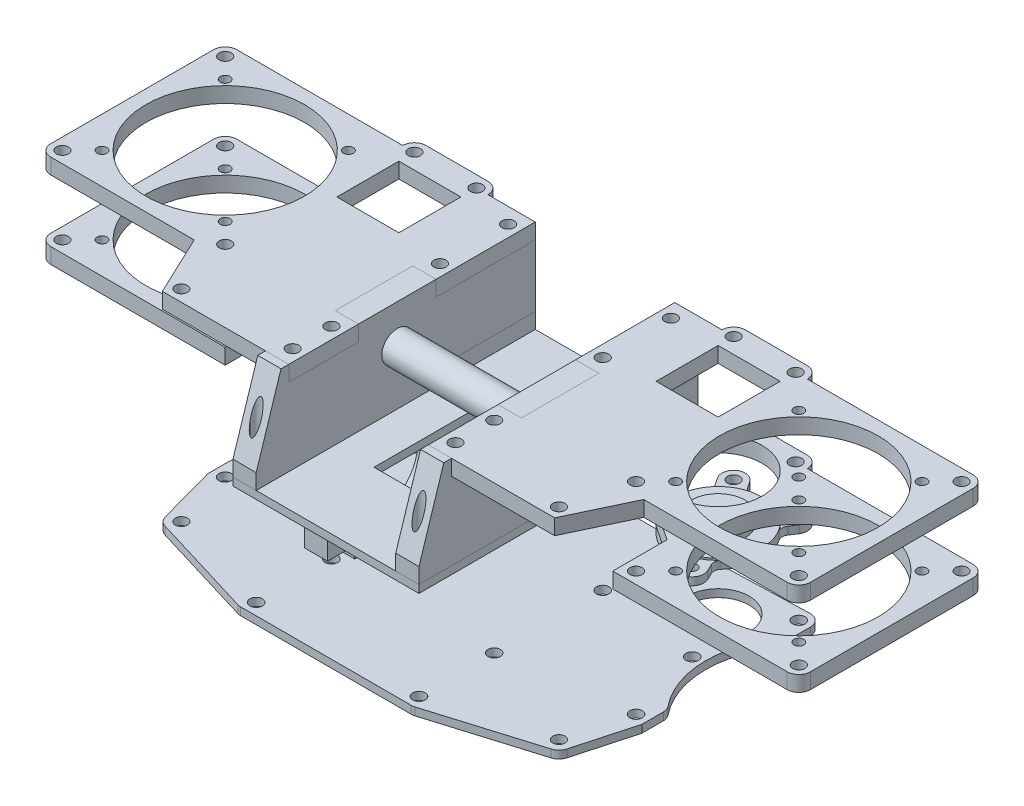
from build123d import *
from build123d.topology import SkipClean

# Parameters (mm, degrees)
BOSS_EXTRUDE1_DEPTH      = 9.525
SKETCH7_R                = 32.5
SKETCH7_R_2              = 3.175
BOSS_EXTRUDE2_DEPTH      = 6.35
SKETCH8_R                = 32.5
SKETCH8_R_2              = 18
BOSS_EXTRUDE3_DEPTH      = 6.35
BOSS_EXTRUDE4_DEPTH      = 6.35
BOSS_EXTRUDE5_START      = 31.75
BOSS_EXTRUDE5_DEPTH      = 6.35
SKETCH15_R               = 2.4892
CUT_EXTRUDE9_DEPTH       = 178.374267088
SKETCH16_R               = 6.35
CUT_EXTRUDE10_DEPTH      = 9.525
SKETCH19_R               = 2.0193
CUT_EXTRUDE11_DEPTH      = 178.374267088
SKETCH22_R               = 2.0193
CUT_EXTRUDE12_DEPTH      = 6.35
SKETCH41_R               = 2.0193
CUT_EXTRUDE23_DEPTH      = 178.374267088
CHAMFER1_SIZE            = 12.7
CHAMFER1_SIZE2           = 19.05
SKETCH42_W               = 25.4
SKETCH42_H               = 25.4
CUT_EXTRUDE24_DEPTH      = 6.35
SKETCH17_R               = 6.35
BOSS_EXTRUDE6_DEPTH      = 76.2
SKETCH24_W               = 76.2
SKETCH24_H               = 114.3
SKETCH24_R               = 2.5527
BOSS_EXTRUDE8_DEPTH      = 3.175
SKETCH25_W               = 25.4
SKETCH25_H               = 50.8
CUT_EXTRUDE13_DEPTH      = 178.374267088
SKETCH34_R               = 2.0193
CUT_EXTRUDE20_DEPTH      = 6.35
SKETCH21_R               = 2.5527
SKETCH21_R_2             = 2.4892
BOSS_EXTRUDE7_DEPTH      = 3.175
SKETCH26_W               = 57.15
SKETCH26_H               = 41.275
SKETCH26_R               = 18
BOSS_EXTRUDE9_DEPTH      = 9.525
SKETCH27_R               = 2.5527
CUT_EXTRUDE14_DEPTH      = 192.897168101
SKETCH28_W               = 11.1125
SKETCH28_H               = 4.7625
CUT_EXTRUDE15_DEPTH      = 228.583503906
SKETCH30_R               = 2.5527
CUT_EXTRUDE16_DEPTH      = 194.284236941
CUT_EXTRUDE17_REACH      = 193.897
CUT_EXTRUDE17_END_RADIUS = 18
SKETCH31_R               = 2.0193
SKETCH32_W               = 57.15
SKETCH32_H               = 0.254
CUT_EXTRUDE18_DEPTH      = 228.583503906
CUT_EXTRUDE19_DEPTH      = 3.175
FILLET1_R                = 4.7625
SKETCH35_R               = 2.0193
SKETCH35_R_2             = 2.4892
BOSS_EXTRUDE10_DEPTH     = 3.175
SKETCH36_R               = 18
BOSS_EXTRUDE11_DEPTH     = 0.762
SKETCH37_R               = 10.9982
BOSS_EXTRUDE12_DEPTH     = 2.413
SKETCH38_R               = 3.9878
CUT_EXTRUDE21_DEPTH      = 182.44784719
FILLET2_R                = 3.175
SKETCH39_R               = 12.7
CUT_EXTRUDE22_DEPTH      = 3.175


with BuildPart() as part:
    # Sketch6 → Boss-Extrude1 (new body)
    with BuildSketch(Plane(origin=(28.575, 0, 0), x_dir=(0, 0, -1), z_dir=(1, 0, 0))):
        Polygon((-76.2, 60.325), (-66.04, 92.075), (-62.865, 92.075), (-62.865, 85.725), (-34.29, 85.725), (-34.29, 92.075), (-2.54, 92.075), (-2.54, 85.725), (38.1, 85.725), (38.1, 60.325), (-2.54, 60.325), (-2.54, 53.975), (-76.2, 53.975), align=None)
    extrude(amount=BOSS_EXTRUDE1_DEPTH)

    # Sketch16 → Cut-Extrude10 (cut)
    with BuildSketch(Plane.ZY.offset(-28.575)):
        with Locations((18.415, 76.2)):
            Circle(SKETCH16_R)
    extrude(amount=-CUT_EXTRUDE10_DEPTH, mode=Mode.SUBTRACT)

    # Sketch19 → Cut-Extrude11 (cut, through all)
    with BuildSketch(Plane.XZ.offset(-53.975)):
        with Locations(Location((33.3375, -3.81, 0), (0, 0, 270))):
            Circle(SKETCH19_R)
        with Locations(Location((33.3375, -31.75, 0), (0, 0, 270))):
            Circle(SKETCH19_R)
        with Locations(Location((33.3375, 40.64, 0), (0, 0, 270))):
            Circle(SKETCH19_R)
        with Locations(Location((33.3375, 71.4375, 0), (0, 0, 270))):
            Circle(SKETCH19_R)
        with Locations(Location((33.3375, 56.515, 0), (0, 0, 270))):
            Circle(SKETCH19_R)
    extrude(amount=-CUT_EXTRUDE11_DEPTH, mode=Mode.SUBTRACT)


with BuildPart() as body_2:
    # Sketch7 → Boss-Extrude2 (new body)
    with BuildSketch(Plane(origin=(0, 85.725, 0), x_dir=(1, 0, 0), z_dir=(0, 1, 0))):
        Polygon((28.575, -62.865), (80.340904861, -62.865), (92.075, -38.1), (117.475, -38.1), (155.575, -38.1), (155.575, 38.1), (28.575, 38.1), (28.575, -2.54), (38.1, -2.54), (38.1, -34.29), (28.575, -34.29), align=None)
        with Locations(Location((117.475, 0, 0), (0, 0, 90))):
            Circle(SKETCH7_R, mode=Mode.SUBTRACT)
        with Locations(Location((65.388447716, 19.05, 0), (0, 0, 90))):
            Circle(SKETCH7_R_2, mode=Mode.SUBTRACT)
    extrude(amount=BOSS_EXTRUDE2_DEPTH)

    # Sketch14<2> → Boss-Extrude5 (add)
    with BuildSketch(Plane(origin=(0, 60.325, 0), x_dir=(1, 0, 0), z_dir=(0, 1, 0)).offset(BOSS_EXTRUDE5_START)):
        with BuildLine():
            Line((78.088447716, 42.8625), (52.688447716, 42.8625))
            ThreePointArc((52.688447716, 42.8625), (49.320851671, 34.732403955), (57.450947716, 38.1))
            Line((57.450947716, 38.1), (73.325947716, 38.1))
            ThreePointArc((73.325947716, 38.1), (81.456043762, 34.732403955), (78.088447716, 42.8625))
        make_face()
    extrude(amount=-BOSS_EXTRUDE5_DEPTH)


with BuildPart() as body_3:
    # Sketch8 → Boss-Extrude3 (new body)
    with BuildSketch(Plane(origin=(0, 60.325, 0), x_dir=(-1, 0, 0), z_dir=(0, -1, 0))):
        Polygon((-79.375, -38.1), (-155.575, -38.1), (-155.575, 38.1), (-79.375, 38.1), (-28.575, 38.1), (-28.575, -2.54), (-38.1, -2.54), (-38.1, -3.175), (-79.375, -3.175), align=None)
        with Locations(Location((-117.475, 0, 0), (0, 0, 90))):
            Circle(SKETCH8_R, mode=Mode.SUBTRACT)
        with Locations(Location((-65.388447716, 19.05, 0), (0, 0, 90))):
            Circle(SKETCH8_R_2, mode=Mode.SUBTRACT)
    extrude(amount=BOSS_EXTRUDE3_DEPTH)

    # Sketch14 → Boss-Extrude4 (add)
    with BuildSketch(Plane(origin=(0, 60.325, 0), x_dir=(1, 0, 0), z_dir=(0, 1, 0))):
        with BuildLine():
            Line((78.088447716, 42.8625), (52.688447716, 42.8625))
            ThreePointArc((52.688447716, 42.8625), (49.320851671, 34.732403955), (57.450947716, 38.1))
            Line((57.450947716, 38.1), (73.325947716, 38.1))
            ThreePointArc((73.325947716, 38.1), (81.456043762, 34.732403955), (78.088447716, 42.8625))
        make_face()
    extrude(amount=-BOSS_EXTRUDE4_DEPTH)


with BuildPart() as cut_extrude9_tool:
    # Sketch15 → Cut-Extrude9 (new, through all)
    with BuildSketch(Plane.XZ.offset(-53.975)):
        with Locations(Location((52.688447716, -38.1, 0), (0, 0, 270))):
            Circle(SKETCH15_R)
        with Locations(Location((78.088447716, -38.1, 0), (0, 0, 270))):
            Circle(SKETCH15_R)
        with Locations(Location((150.8125, -33.3375, 0), (0, 0, 270))):
            Circle(SKETCH15_R)
        with Locations(Location((150.8125, 33.3375, 0), (0, 0, 270))):
            Circle(SKETCH15_R)
        with Locations(Location((84.1375, 33.3375, 0), (0, 0, 270))):
            Circle(SKETCH15_R)
        with Locations(Location((33.3375, -31.75, 0), (0, 0, 270))):
            Circle(SKETCH15_R)
        with Locations(Location((33.3375, -3.81, 0), (0, 0, 270))):
            Circle(SKETCH15_R)
        with Locations(Location((33.3375, 40.64, 0), (0, 0, 270))):
            Circle(SKETCH15_R)
        with Locations(Location((77.327408996, 58.1025, 0), (0, 0, 270))):
            Circle(SKETCH15_R)
        with Locations(Location((33.3375, 56.515, 0), (0, 0, 270))):
            Circle(SKETCH15_R)
        with BuildLine():
            Line((150.8125, 38.1), (155.575, 38.1))
            Line((155.575, 38.1), (155.575, 33.3375))
            ThreePointArc((155.575, 33.3375), (154.180096045, 36.705096045), (150.8125, 38.1))
        make_face()
        with BuildLine():
            Line((150.8125, -38.1), (155.575, -38.1))
            Line((155.575, -38.1), (155.575, -33.3375))
            ThreePointArc((155.575, -33.3375), (154.180096045, -36.705096045), (150.8125, -38.1))
        make_face()
    extrude(amount=-CUT_EXTRUDE9_DEPTH)


with BuildPart() as body_3_1:
    add(body_3.part)

    # Cut-Extrude9: cut by cut_extrude9_tool
    add(cut_extrude9_tool.part, mode=Mode.SUBTRACT)

    # Sketch22 → Cut-Extrude12 (cut)
    with BuildSketch(Plane.XZ.offset(-53.975)):
        with Locations(Location((84.1375, -33.3375, 0), (0, 0, 270))):
            Circle(SKETCH22_R)
    extrude(amount=-CUT_EXTRUDE12_DEPTH, mode=Mode.SUBTRACT)


with BuildPart() as body_2_1:
    add(body_2.part)

    # Cut-Extrude9: cut by cut_extrude9_tool
    add(cut_extrude9_tool.part, mode=Mode.SUBTRACT)


with BuildPart() as cut_extrude23_tool:
    # Sketch41 → Cut-Extrude23 (new, through all)
    with BuildSketch(Plane(origin=(0, 92.075, 0), x_dir=(1, 0, 0), z_dir=(0, 1, 0))):
        with Locations(Location((92.248965581, 25.226034419, 0), (0, 0, 270))):
            Circle(SKETCH41_R)
        with Locations(Location((142.701034419, 25.226034419, 0), (0, 0, 270))):
            Circle(SKETCH41_R)
        with Locations(Location((142.701034419, -25.226034419, 0), (0, 0, 270))):
            Circle(SKETCH41_R)
        with Locations(Location((92.248965581, -25.226034419, 0), (0, 0, 270))):
            Circle(SKETCH41_R)
    extrude(amount=-CUT_EXTRUDE23_DEPTH)


with BuildPart() as body_2_2:
    add(body_2_1.part)

    # Cut-Extrude23: cut by cut_extrude23_tool
    add(cut_extrude23_tool.part, mode=Mode.SUBTRACT)

    # Sketch42 → Cut-Extrude24 (cut)
    with BuildSketch(Plane(origin=(0, 92.075, 0), x_dir=(1, 0, 0), z_dir=(0, 1, 0))):
        with Locations((65.388447716, 19.05)):
            Rectangle(SKETCH42_W, SKETCH42_H)
    extrude(amount=-CUT_EXTRUDE24_DEPTH, mode=Mode.SUBTRACT)


with BuildPart() as body_3_2:
    add(body_3_1.part)

    # Cut-Extrude23: cut by cut_extrude23_tool
    add(cut_extrude23_tool.part, mode=Mode.SUBTRACT)

    # Chamfer1
    chamfer1_edges = [body_3_2.edges().sort_by_distance(p)[0] for p in [
        (79.375, 57.15, 3.175),
    ]]
    chamfer1_side = [body_3_2.faces().sort_by_distance(p)[0] for p in [
        (79.375, 57.15, 20.6375),
    ]]
    chamfer(chamfer1_edges, length=CHAMFER1_SIZE, length2=CHAMFER1_SIZE2, reference=chamfer1_side[0])


with BuildPart() as body_4:
    # Mirror2: mirrored copy
    add(part.part.mirror(Plane(origin=(0, 0, 0), x_dir=(0, 0, 1), z_dir=(1, 0, 0))))


with BuildPart() as body_5:
    # Mirror2 2: mirrored copy
    add(body_2_2.part.mirror(Plane(origin=(0, 0, 0), x_dir=(0, 0, 1), z_dir=(1, 0, 0))))


with BuildPart() as body_6:
    # Mirror2 3: mirrored copy
    add(body_3_2.part.mirror(Plane(origin=(0, 0, 0), x_dir=(0, 0, 1), z_dir=(1, 0, 0))))


with BuildPart() as body_7:
    # Sketch17 → Boss-Extrude6 (new body)
    with BuildSketch(Plane(origin=(38.1, 0, 0), x_dir=(0, 0, -1), z_dir=(1, 0, 0))):
        with Locations((-18.415, 76.2)):
            Circle(SKETCH17_R)
    extrude(amount=-BOSS_EXTRUDE6_DEPTH)


with BuildPart() as body_8:
    # Sketch24 → Boss-Extrude8 (new body)
    with BuildSketch(Plane.XZ.offset(-53.975)):
        with Locations((0, 19.05)):
            Rectangle(SKETCH24_W, SKETCH24_H)
        with Locations(Location((-33.3375, 71.4375, 0), (0, 0, 270))):
            Circle(SKETCH24_R, mode=Mode.SUBTRACT)
        with Locations(Location((33.3375, 71.4375, 0), (0, 0, 270))):
            Circle(SKETCH24_R, mode=Mode.SUBTRACT)
        with Locations(Location((33.3375, 40.64, 0), (0, 0, 270))):
            Circle(SKETCH24_R, mode=Mode.SUBTRACT)
        with Locations(Location((-33.3375, 40.64, 0), (0, 0, 270))):
            Circle(SKETCH24_R, mode=Mode.SUBTRACT)
        with Locations(Location((-33.3375, -3.81, 0), (0, 0, 270))):
            Circle(SKETCH24_R, mode=Mode.SUBTRACT)
        with Locations(Location((33.3375, -3.81, 0), (0, 0, 270))):
            Circle(SKETCH24_R, mode=Mode.SUBTRACT)
        with Locations(Location((33.3375, -31.75, 0), (0, 0, 270))):
            Circle(SKETCH24_R, mode=Mode.SUBTRACT)
        with Locations(Location((-33.3375, -31.75, 0), (0, 0, 270))):
            Circle(SKETCH24_R, mode=Mode.SUBTRACT)
        with Locations(Location((33.3375, 56.515, 0), (0, 0, 270))):
            Circle(SKETCH24_R, mode=Mode.SUBTRACT)
        with Locations(Location((-33.3375, 56.515, 0), (0, 0, 270))):
            Circle(SKETCH24_R, mode=Mode.SUBTRACT)
    extrude(amount=BOSS_EXTRUDE8_DEPTH)

    # Sketch25 → Cut-Extrude13 (cut, through all)
    with BuildSketch(Plane(origin=(0, 53.975, 0), x_dir=(1, 0, 0), z_dir=(0, 1, 0))):
        with Locations((0, -18.415)):
            Rectangle(SKETCH25_W, SKETCH25_H)
    extrude(amount=-CUT_EXTRUDE13_DEPTH, mode=Mode.SUBTRACT)


with BuildPart() as cut_extrude20_tool:
    # Sketch34 → Cut-Extrude20 (new body)
    with BuildSketch(Plane.XZ.offset(-53.975)):
        with Locations(Location((75.276593569, 1.452584663, 0), (0, 0, 270))):
            Circle(SKETCH34_R)
        with Locations(Location((-75.276593569, 1.452584663, 0), (0, 0, 270))):
            Circle(SKETCH34_R)
        with Locations(Location((42.8625, -15.776914951, 0), (0, 0, 270))):
            Circle(SKETCH34_R)
        with Locations(Location((-42.8625, -15.776914951, 0), (0, 0, 270))):
            Circle(SKETCH34_R)
    extrude(amount=-CUT_EXTRUDE20_DEPTH)


with BuildPart() as body_3_3:
    add(body_3_2.part)

    # Cut-Extrude20: cut by cut_extrude20_tool
    add(cut_extrude20_tool.part, mode=Mode.SUBTRACT)


with BuildPart() as body_6_1:
    add(body_6.part)

    # Cut-Extrude20: cut by cut_extrude20_tool
    add(cut_extrude20_tool.part, mode=Mode.SUBTRACT)


with BuildPart() as body_9:
    # Sketch21 → Boss-Extrude7 (new body)
    with BuildSketch(Plane(origin=(0, 9.525, 0), x_dir=(-1, 0, 0), z_dir=(0, -1, 0))):
        Polygon((-88.9, -35.71875), (-88.9, 38.251152997), (-33.263104096, 36.5125), (33.263104096, 36.5125), (88.9, 38.251152997), (88.9, -35.71875), (81.599955368, -62.265473852), (35.632311037, -76.2), (34.925, -76.2), (-34.925, -76.2), (-35.632311037, -76.2), (-81.599955368, -62.265473852), align=None)
        with Locations(Location((-84.1375, 33.3375, 0), (0, 0, 90))):
            Circle(SKETCH21_R, mode=Mode.SUBTRACT)
        with Locations(Location((-84.1375, -33.3375, 0), (0, 0, 90))):
            Circle(SKETCH21_R, mode=Mode.SUBTRACT)
        with Locations(Location((-33.3375, 31.75, 0), (0, 0, 90))):
            Circle(SKETCH21_R, mode=Mode.SUBTRACT)
        with Locations(Location((-33.3375, 3.81, 0), (0, 0, 90))):
            Circle(SKETCH21_R, mode=Mode.SUBTRACT)
        with Locations(Location((-33.3375, -40.64, 0), (0, 0, 90))):
            Circle(SKETCH21_R, mode=Mode.SUBTRACT)
        with Locations(Location((-33.3375, -71.4375, 0), (0, 0, 90))):
            Circle(SKETCH21_R, mode=Mode.SUBTRACT)
        with Locations(Location((33.3375, -71.4375, 0), (0, 0, 90))):
            Circle(SKETCH21_R, mode=Mode.SUBTRACT)
        with Locations(Location((33.3375, -40.64, 0), (0, 0, 90))):
            Circle(SKETCH21_R, mode=Mode.SUBTRACT)
        with Locations(Location((33.3375, 3.81, 0), (0, 0, 90))):
            Circle(SKETCH21_R, mode=Mode.SUBTRACT)
        with Locations(Location((33.3375, 31.75, 0), (0, 0, 90))):
            Circle(SKETCH21_R, mode=Mode.SUBTRACT)
        with Locations(Location((84.1375, 33.3375, 0), (0, 0, 90))):
            Circle(SKETCH21_R, mode=Mode.SUBTRACT)
        with Locations(Location((84.1375, -33.3375, 0), (0, 0, 90))):
            Circle(SKETCH21_R, mode=Mode.SUBTRACT)
        with Locations(Location((-77.327408996, -58.1025, 0), (0, 0, 90))):
            Circle(SKETCH21_R_2, mode=Mode.SUBTRACT)
        with Locations(Location((-75.276593569, -1.452584663, 0), (0, 0, 90))):
            Circle(SKETCH21_R, mode=Mode.SUBTRACT)
        with Locations(Location((75.276593569, -1.452584663, 0), (0, 0, 90))):
            Circle(SKETCH21_R, mode=Mode.SUBTRACT)
        with Locations(Location((-42.8625, 15.776914951, 0), (0, 0, 90))):
            Circle(SKETCH21_R, mode=Mode.SUBTRACT)
        with Locations(Location((42.8625, 15.776914951, 0), (0, 0, 90))):
            Circle(SKETCH21_R, mode=Mode.SUBTRACT)
        with Locations(Location((77.327408996, -58.1025, 0), (0, 0, 90))):
            Circle(SKETCH21_R_2, mode=Mode.SUBTRACT)
    extrude(amount=BOSS_EXTRUDE7_DEPTH)

    # Sketch30 → Cut-Extrude16 (cut, through all)
    with BuildSketch(Plane.XZ.offset(-6.35)):
        with Locations(Location((-33.3375, 31.115, 0), (0, 0, 270))):
            Circle(SKETCH30_R)
        with Locations(Location((-33.3375, 5.715, 0), (0, 0, 270))):
            Circle(SKETCH30_R)
    extrude(amount=-CUT_EXTRUDE16_DEPTH, mode=Mode.SUBTRACT)

    # Sketch33 → Cut-Extrude19 (cut)
    with BuildSketch(Plane.XZ.offset(-6.35)):
        with BuildLine():
            Line((88.9, -25.200781238), (88.9, 25.200781238))
            ThreePointArc((88.9, 25.200781238), (79.375, 0), (88.9, -25.200781238))
        make_face()
        with BuildLine():
            Line((-88.9, -25.200781238), (-88.9, 25.200781238))
            ThreePointArc((-88.9, 25.200781238), (-79.375, 0), (-88.9, -25.200781238))
        make_face()
    extrude(amount=-CUT_EXTRUDE19_DEPTH, mode=Mode.SUBTRACT)

    # Fillet1
    fillet1_edges = [body_9.edges().sort_by_distance(p)[0] for p in [
        (88.9, 7.9375, -25.200781238),
        (88.9, 7.9375, 25.200781238),
        (-88.9, 7.9375, 25.200781238),
        (-88.9, 7.9375, -25.200781238),
        (88.9, 7.9375, -38.251152997),
        (-88.9, 7.9375, -38.251152997),
        (-81.599955368, 7.9375, 62.265473852),
        (-35.632311037, 7.9375, 76.2),
        (35.632311037, 7.9375, 76.2),
        (81.599955368, 7.9375, 62.265473852),
    ]]
    fillet(fillet1_edges, radius=FILLET1_R)

    # Sketch39 → Cut-Extrude22 (cut)
    with BuildSketch(Plane.XZ.offset(-6.35)):
        with Locations(Location((-65.388447716, -19.05, 0), (0, 0, 270))):
            Circle(SKETCH39_R)
        with Locations(Location((65.388447716, -19.05, 0), (0, 0, 270))):
            Circle(SKETCH39_R)
    extrude(amount=-CUT_EXTRUDE22_DEPTH, mode=Mode.SUBTRACT)


with BuildPart() as body_10:
    # Sketch26 → Boss-Extrude9 (new body)
    with BuildSketch(Plane.ZY.offset(38.1)):
        with Locations((18.415, 30.1625)):
            Rectangle(SKETCH26_W, SKETCH26_H)
        with Locations((18.415, 28.575)):
            Circle(SKETCH26_R, mode=Mode.SUBTRACT)
    extrude(amount=-BOSS_EXTRUDE9_DEPTH)

    # Sketch27 → Cut-Extrude14 (cut, through all)
    with BuildSketch(Plane.XZ.offset(-9.525)):
        with Locations(Location((-33.3375, -3.81, 0), (0, 0, 270))):
            Circle(SKETCH27_R)
        with Locations(Location((-33.3375, 40.64, 0), (0, 0, 270))):
            Circle(SKETCH27_R)
    extrude(amount=-CUT_EXTRUDE14_DEPTH, mode=Mode.SUBTRACT)

    # Sketch28 → Cut-Extrude15 (cut, through all)
    with BuildSketch(Plane.ZY.offset(38.1)):
        with Locations((-4.60375, 11.90625)):
            Rectangle(SKETCH28_W, SKETCH28_H)
        with Locations((41.43375, 11.90625)):
            Rectangle(SKETCH28_W, SKETCH28_H)
    extrude(amount=-CUT_EXTRUDE15_DEPTH, mode=Mode.SUBTRACT)

    # Cut-Extrude17: up to this cylinder (the profile starts outside it)
    cut_extrude17_end = Plane(origin=(-33.3375, 28.575, 18.415), z_dir=(-1, 0, 0)) * Cylinder(CUT_EXTRUDE17_END_RADIUS, 424.794, mode=Mode.PRIVATE)
    # Sketch31 → Cut-Extrude17 (cut, up to the surface)
    with BuildSketch(Plane.XZ.offset(-9.525), mode=Mode.PRIVATE) as cut_extrude17_sk1:
        with Locations(Location((-33.3375, 5.715, 0), (0, 0, 270))):
            Circle(SKETCH31_R)
    cut_extrude17_tool1 = extrude(cut_extrude17_sk1.sketch, amount=-CUT_EXTRUDE17_REACH, mode=Mode.PRIVATE) - cut_extrude17_end
    add(cut_extrude17_tool1.solids().sort_by_distance((-33.3375, 9.525, 5.715))[0], mode=Mode.SUBTRACT)
    # Sketch31 → Cut-Extrude17 (cut, up to the surface)
    with BuildSketch(Plane.XZ.offset(-9.525), mode=Mode.PRIVATE) as cut_extrude17_sk2:
        with Locations(Location((-33.3375, 31.115, 0), (0, 0, 270))):
            Circle(SKETCH31_R)
    cut_extrude17_tool2 = extrude(cut_extrude17_sk2.sketch, amount=-CUT_EXTRUDE17_REACH, mode=Mode.PRIVATE) - cut_extrude17_end
    add(cut_extrude17_tool2.solids().sort_by_distance((-33.3375, 9.525, 31.115))[0], mode=Mode.SUBTRACT)

    # Sketch32 → Cut-Extrude18 (cut, through all)
    with BuildSketch(Plane.ZY.offset(38.1)):
        with Locations((18.415, 28.575)):
            Rectangle(SKETCH32_W, SKETCH32_H)
    extrude(amount=-CUT_EXTRUDE18_DEPTH, mode=Mode.SUBTRACT)


with BuildPart() as cut_extrude18_piece_1:
    # of the separate pieces the step leaves, piece 1, a body of its own (cut_extrude18_pieces)
    add(body_10.part.solids().sort_by_distance((-38.1, 50.8, -10.16))[0])


with BuildPart() as cut_extrude18_piece_2:
    # of the separate pieces the step leaves, piece 2, a body of its own (cut_extrude18_pieces)
    add(body_10.part.solids().sort_by_distance((-38.1, 9.525, 0.9525))[0])


with BuildPart() as body_12:
    # Sketch35 → Boss-Extrude10 (new body)
    with BuildSketch(Plane(origin=(0, 41.275, 0), x_dir=(-1, 0, 0), z_dir=(0, -1, 0))):
        with BuildLine():
            Line((-79.5662612, 0.616269577), (-77.218749503, 5.483719757))
            ThreePointArc((-77.218749503, 5.483719757), (-83.345227072, 17.803374484), (-78.979867719, 30.85141103))
            Line((-78.979867719, 30.85141103), (-82.051087243, 35.458240315))
            ThreePointArc((-82.051087243, 35.458240315), (-80.730207401, 42.062639527), (-74.125808189, 40.741759685))
            Line((-74.125808189, 40.741759685), (-71.054588666, 36.134930399))
            ThreePointArc((-71.054588666, 36.134930399), (-65.388447716, 37.05), (-59.722306767, 36.134930399))
            Line((-59.722306767, 36.134930399), (-56.651087243, 40.741759685))
            ThreePointArc((-56.651087243, 40.741759685), (-50.046688032, 42.062639527), (-48.725808189, 35.458240315))
            Line((-48.725808189, 35.458240315), (-51.797027713, 30.85141103))
            ThreePointArc((-51.797027713, 30.85141103), (-48.947349111, 26.37736492), (-47.525496537, 21.266974329))
            Line((-47.525496537, 21.266974329), (-42.177686489, 20.489922134))
            ThreePointArc((-42.177686489, 20.489922134), (-38.149492817, 15.09210144), (-43.547313511, 11.063907769))
            Line((-43.547313511, 11.063907769), (-48.895123559, 11.840959963))
            ThreePointArc((-48.895123559, 11.840959963), (-56.940016152, 3.155850004), (-68.63941424, 1.346011278))
            Line((-68.63941424, 1.346011278), (-70.986925937, -3.521438902))
            ThreePointArc((-70.986925937, -3.521438902), (-77.345447808, -5.742252294), (-79.5662612, 0.616269577))
        make_face()
        with Locations(Location((-75.276593569, -1.452584663, 0), (0, 0, 90))):
            Circle(SKETCH35_R, mode=Mode.SUBTRACT)
        with Locations(Location((-42.8625, 15.776914951, 0), (0, 0, 90))):
            Circle(SKETCH35_R, mode=Mode.SUBTRACT)
        with Locations(Location((-52.688447716, 38.1, 0), (0, 0, 90))):
            Circle(SKETCH35_R_2, mode=Mode.SUBTRACT)
        with Locations(Location((-78.088447716, 38.1, 0), (0, 0, 90))):
            Circle(SKETCH35_R_2, mode=Mode.SUBTRACT)
    extrude(amount=BOSS_EXTRUDE10_DEPTH)

    # Sketch36 → Boss-Extrude11 (add)
    with SkipClean():  # the faces are left unmerged after this step: merging them gives an invalid solid
        with BuildSketch(Plane(origin=(0, 41.275, 0), x_dir=(1, 0, 0), z_dir=(0, 1, 0))):
            with Locations(Location((65.388447716, 19.05, 0), (0, 0, 280.405248975))):
                Circle(SKETCH36_R)
        extrude(amount=BOSS_EXTRUDE11_DEPTH)

    # Sketch37 → Boss-Extrude12 (add)
    with SkipClean():  # the faces are left unmerged after this step: merging them gives an invalid solid
        with BuildSketch(Plane(origin=(0, 42.037, 0), x_dir=(1, 0, 0), z_dir=(0, 1, 0))):
            with Locations(Location((65.388447716, 19.05, 0), (0, 0, 90))):
                Circle(SKETCH37_R)
        extrude(amount=BOSS_EXTRUDE12_DEPTH)

    # Sketch38 → Cut-Extrude21 (cut, through all)
    with SkipClean():  # the faces are left unmerged after this step: merging them gives an invalid solid
        with BuildSketch(Plane.XZ.offset(-38.1)):
            with Locations(Location((65.388447716, -19.05, 0), (0, 0, 270))):
                Circle(SKETCH38_R)
        extrude(amount=-CUT_EXTRUDE21_DEPTH, mode=Mode.SUBTRACT)

    # Fillet2
    # the kernel refuses this fillet: 3.175 mm, written as the material it adds along each edge
    with BuildSketch(Plane(origin=(77.218749503, 41.275, -5.483719757), x_dir=(0.7141534145519814, 0, -0.6999892145481569), z_dir=(0, -1, 0)), Plane(origin=(71.054588666, 41.275, -36.134930399), x_dir=(-0.9658744295384044, 0, -0.259010784261702), z_dir=(0, -1, 0)), Plane(origin=(51.797027713, 41.275, -30.85141103), x_dir=(-0.6105770429871129, 0, 0.7919568640886403), z_dir=(0, -1, 0)), Plane(origin=(48.895123559, 41.275, -11.840959963), x_dir=(0.4531517370962601, 0, 0.8914333980543032), z_dir=(0, -1, 0))) as fillet2_piece_1:
        with BuildLine():
            CenterArc((2.279983772, 3.169618201), FILLET2_R, 198.67869384, 67.984808193)
            Line((-0.727787188, 2.152790363), (0, 0))
            ThreePointArc((0, 0), (1.047599436, 0.030510986), (2.095198871, 0))
        make_face()
    extrude(amount=3.175)
    with BuildSketch(Plane(origin=(78.979867719, 41.275, -30.85141103), x_dir=(0.6105770429871108, 0, 0.791956864088642), z_dir=(0, -1, 0)), Plane(origin=(59.722306767, 41.275, -36.134930399), x_dir=(0.9658744295384033, 0, -0.259010784261706), z_dir=(0, -1, 0)), Plane(origin=(47.525496537, 41.275, -21.266974329), x_dir=(0.18071331302836935, 0, -0.9835358145458205), z_dir=(0, -1, 0)), Plane(origin=(68.63941424, 41.275, -1.346011278), x_dir=(-0.9923992022654122, 0, 0.12306024273896711), z_dir=(0, -1, 0))) as fillet2_piece_2:
        with BuildLine():
            CenterArc((2.279983772, -3.169618201), FILLET2_R, 93.336497967, 67.984808193)
            Line((-0.727787188, -2.152790363), (0, 0))
            ThreePointArc((0, 0), (1.047599436, -0.030510986), (2.095198871, 0))
        make_face()
    extrude(amount=3.175)


with BuildPart() as body_13:
    # Mirror3: mirrored copy
    add(body_12.part.mirror(Plane(origin=(0, 0, 0), x_dir=(0, 0, 1), z_dir=(1, 0, 0))))


solid = Compound([part.part, body_2_2.part, body_4.part, body_5.part, body_7.part, body_8.part, body_3_3.part, body_6_1.part, body_9.part, cut_extrude18_piece_1.part, cut_extrude18_piece_2.part, body_12.part, body_13.part])
